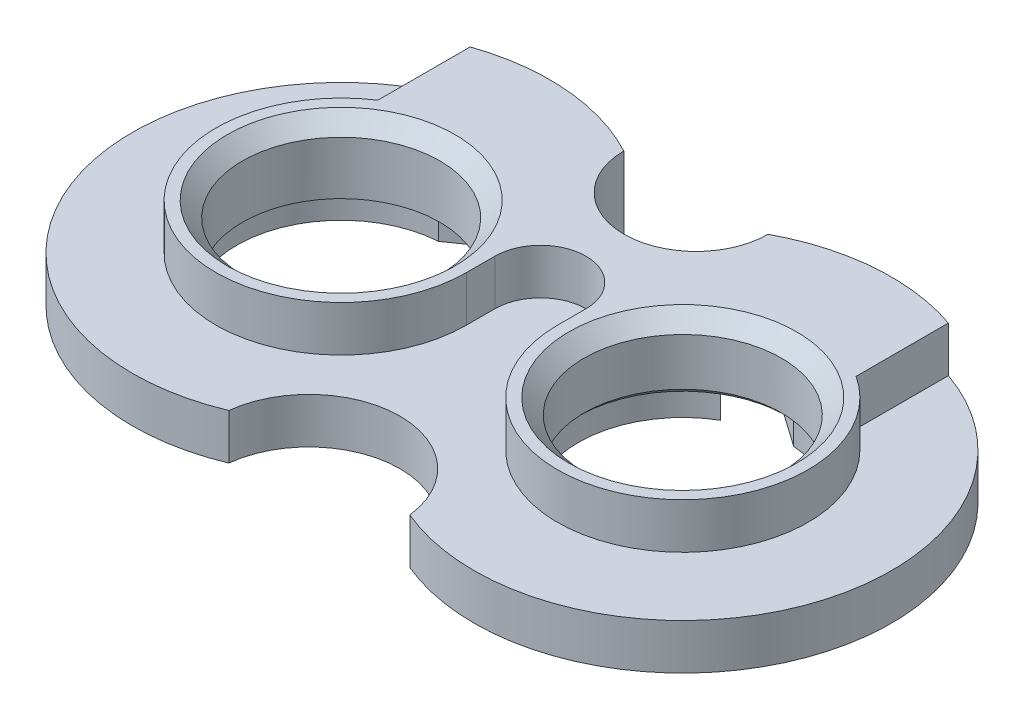
from build123d import *

# Parameters (mm, degrees)
EXTRUDE_1_DEPTH     = 12
SKETCH_2_R          = 9.5
SKETCH_2_R_2        = 12
CUT_EXTRUDE_1_DEPTH = 59.311662641
CUT_EXTRUDE_2_DEPTH = 6
SKETCH_4_R          = 13
CUT_EXTRUDE_3_DEPTH = 59.311662641
CHAMFER_1_SIZE      = 2
CUT_EXTRUDE_4_DEPTH = 3
SKETCH_7_R          = 13.75
CUT_EXTRUDE_5_DEPTH = 3
CHAMFER_2_SIZE      = 0.75


with BuildPart() as part:
    # Эскиз1 → Бобышка-Вытянуть1 (new body)
    with BuildSketch(Plane(origin=(0, 0, 0), x_dir=(1, 0, 0), z_dir=(0, 1, 0))):
        with BuildLine():
            ThreePointArc((0, -15.811388301), (50, 0), (0, 15.811388301))
            ThreePointArc((0, 15.811388301), (-50, 0), (0, -15.811388301))
        make_face()
    extrude(amount=EXTRUDE_1_DEPTH)

    # Эскиз2 → Вырез-Вытянуть1 (cut, through all)
    with BuildSketch(Plane(origin=(0, 0, 0), x_dir=(1, 0, 0), z_dir=(0, 1, 0))):
        with Locations((0, 24.25)):
            Circle(SKETCH_2_R)
        with Locations((0, -26.75)):
            Circle(SKETCH_2_R_2)
    extrude(amount=CUT_EXTRUDE_1_DEPTH, mode=Mode.SUBTRACT)

    # Эскиз3 → Вырез-Вытянуть2 (cut)
    with BuildSketch(Plane(origin=(0, 12, 0), x_dir=(1, 0, 0), z_dir=(0, 1, 0))):
        with BuildLine():
            Line((-6, 0), (-6, 3.75))
            ThreePointArc((-6, 3.75), (0, 9.75), (6, 3.75))
            Line((6, 3.75), (6, 0))
            ThreePointArc((6, 0), (30.366066361, -14.504309704), (31.5, 13.829316686))
            Line((31.5, 13.829316686), (31.5, 40))
            Line((31.5, 40), (71.5, 40))
            Line((71.5, 40), (71.5, -30))
            Line((71.5, -30), (-71.5, -30))
            Line((-71.5, -30), (-71.5, 40))
            Line((-71.5, 40), (-31.5, 40))
            Line((-31.5, 40), (-31.5, 13.829316686))
            ThreePointArc((-31.5, 13.829316686), (-30.366066361, -14.504309704), (-6, 0))
        make_face()
    extrude(amount=-CUT_EXTRUDE_2_DEPTH, mode=Mode.SUBTRACT)

    # Эскиз4 → Вырез-Вытянуть3 (cut, through all)
    with BuildSketch(Plane(origin=(0, 0, 0), x_dir=(1, 0, 0), z_dir=(0, 1, 0))):
        with Locations(Location((-22.5, 0, 0), (0, 0, 270))):
            Circle(SKETCH_4_R)
        with Locations(Location((22.5, 0, 0), (0, 0, 270))):
            Circle(SKETCH_4_R)
    extrude(amount=CUT_EXTRUDE_3_DEPTH, mode=Mode.SUBTRACT)

    # Фаска1
    chamfer_1_edges = [part.edges().sort_by_distance(p)[0] for p in [
        (-22.5, 12, -13),
        (22.5, 12, -13),
    ]]
    chamfer(chamfer_1_edges, length=CHAMFER_1_SIZE)

    # Эскиз5 → Вырез-Вытянуть4 (cut)
    with BuildSketch(Plane.XZ):
        Polygon((-4.558541382, -19.585087734), (-25.037342489, -5.245676825), (-28.478801107, -10.160589091), (-8, -24.5), align=None)
        Polygon((4.558541382, -19.585087734), (25.037342489, -5.245676825), (28.478801107, -10.160589091), (8, -24.5), align=None)
    extrude(amount=-CUT_EXTRUDE_4_DEPTH, mode=Mode.SUBTRACT)

    # Эскиз7 → Вырез-Вытянуть5 (cut)
    with BuildSketch(Plane.XZ):
        with Locations((-22.5, 0)):
            Circle(SKETCH_7_R)
        with Locations((22.5, 0)):
            Circle(SKETCH_7_R)
    extrude(amount=-CUT_EXTRUDE_5_DEPTH, mode=Mode.SUBTRACT)

    # Фаска2
    chamfer_2_edges = [part.edges().sort_by_distance(p)[0] for p in [
        (22.5, 3, -13),
    ]]
    chamfer(chamfer_2_edges, length=CHAMFER_2_SIZE - 0.0001)  # a hair under: the kernel refuses the full size


solid = part.part
